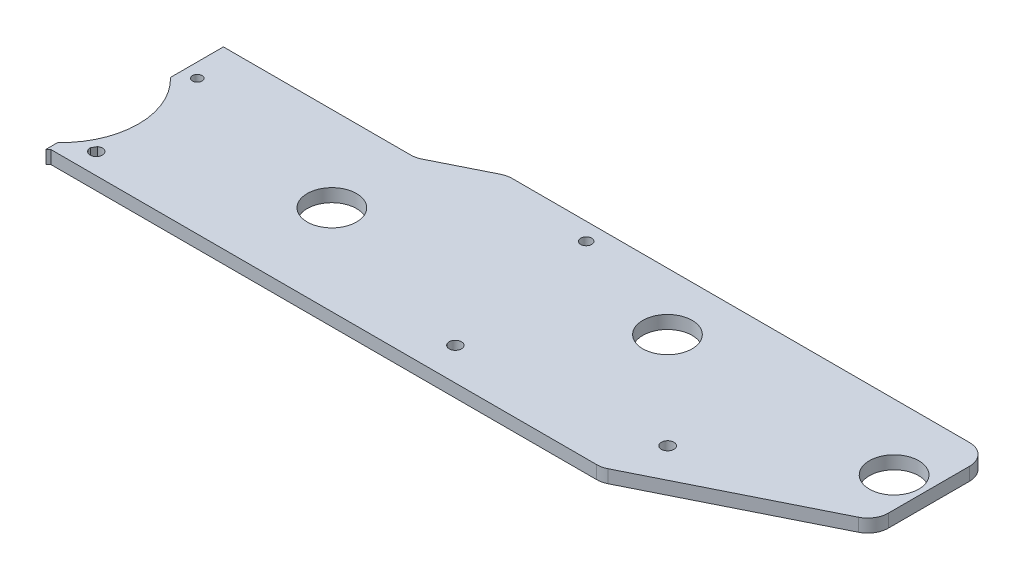
from build123d import *

# Parameters (mm, degrees)
SKETCH1_W           = 210
SKETCH1_H           = 50
SKETCH1_R           = 1.211665018
SKETCH1_R_2         = 1.165617118
SKETCH1_R_3         = 1.5
SKETCH1_R_4         = 1.517273905
SKETCH1_R_5         = 1.335614121
SKETCH1_R_6         = 1.62438417
BOSS_EXTRUDE1_DEPTH = 3.175
SKETCH2_R           = 2
CUT_EXTRUDE1_DEPTH  = 10
SKETCH3_R           = 6
SKETCH3_R_2         = 0.586995366
CUT_EXTRUDE2_DEPTH  = 57.15
CUT_EXTRUDE7_DEPTH  = 10
FILLET3_R           = 5
SKETCH11_R          = 18.5
SKETCH11_R_2        = 2
BOSS_EXTRUDE4_DEPTH = 3.175
SKETCH12_R          = 21
BOSS_EXTRUDE5_DEPTH = 3.175
SKETCH13_R          = 18.85
CUT_EXTRUDE8_DEPTH  = 3.175
BOSS_EXTRUDE6_DEPTH = 3.175
FILLET4_R           = 5
SKETCH15_R          = 1.5
CUT_EXTRUDE9_DEPTH  = 10
SKETCH16_R          = 1.5
CUT_EXTRUDE10_DEPTH = 10
SKETCH17_W          = 82.811100577
SKETCH17_H          = 66.522656387
CUT_EXTRUDE11_DEPTH = 10


with BuildPart() as part:
    # Sketch1 → Boss-Extrude1 (new body)
    with BuildSketch(Plane(origin=(0, 0, 0), x_dir=(1, 0, 0), z_dir=(0, 1, 0))):
        with Locations((105, -25)):
            Rectangle(SKETCH1_W, SKETCH1_H)
        with Locations((3.489526233, -16.787661112)):
            Circle(SKETCH1_R, mode=Mode.SUBTRACT)
        with Locations((34.37258772, -17.194005245)):
            Circle(SKETCH1_R_2, mode=Mode.SUBTRACT)
        with Locations((37.520749958, -44.921198121)):
            Circle(SKETCH1_R_3, mode=Mode.SUBTRACT)
        with Locations((168.975233936, -37.403209633)):
            Circle(SKETCH1_R_4, mode=Mode.SUBTRACT)
        with Locations((116, -4.237214774)):
            Circle(SKETCH1_R_5, mode=Mode.SUBTRACT)
        with Locations((12.257640281, -3.274812063)):
            Circle(SKETCH1_R_6, mode=Mode.SUBTRACT)
    extrude(amount=BOSS_EXTRUDE1_DEPTH)

    # Sketch2 → Cut-Extrude1 (cut)
    with BuildSketch(Plane(origin=(0, 3.175, 0), x_dir=(1, 0, 0), z_dir=(0, 1, 0))):
        with Locations((10, -26)):
            Circle(SKETCH2_R)
        with Locations((10, -42)):
            Circle(SKETCH2_R)
        with Locations((26, -26)):
            Circle(SKETCH2_R)
        with Locations((26, -42)):
            Circle(SKETCH2_R)
    extrude(amount=-CUT_EXTRUDE1_DEPTH, mode=Mode.SUBTRACT)

    # Sketch3 → Cut-Extrude2 (cut)
    with BuildSketch(Plane(origin=(0, 3.175, 0), x_dir=(1, 0, 0), z_dir=(0, 1, 0))):
        with Locations((78.01026379, -28.1)):
            Circle(SKETCH3_R)
        with Locations((145.531297368, -14)):
            Circle(SKETCH3_R)
        with Locations((18, -34)):
            Circle(SKETCH3_R_2)
        with Locations((202.646291021, -16)):
            Circle(SKETCH3_R)
    extrude(amount=-CUT_EXTRUDE2_DEPTH, mode=Mode.SUBTRACT)

    # Sketch10 → Cut-Extrude7 (cut)
    with BuildSketch(Plane(origin=(0, 3.175, 0), x_dir=(1, 0, 0), z_dir=(0, 1, 0))):
        Polygon((210, -27.859435908), (165.502877994, -50), (210, -50), align=None)
        Polygon((92.532613397, 0), (77.65477062, -7.402812063), (0, -7.402812063), (0, 0), align=None)
    extrude(amount=-CUT_EXTRUDE7_DEPTH, mode=Mode.SUBTRACT)

    # Fillet3
    fillet3_edges = [part.edges().sort_by_distance(p)[0] for p in [
        (0, 1.5875, 50),
        (0, 1.5875, 7.402812063),
        (77.65477062, 1.5875, 7.402812063),
        (92.532613397, 1.5875, 0),
        (210, 1.5875, 0),
        (210, 1.5875, 27.859435908),
        (165.502877994, 1.5875, 50),
    ]]
    fillet(fillet3_edges, radius=FILLET3_R)

    # Sketch11 → Boss-Extrude4 (add)
    with BuildSketch(Plane(origin=(0, 3.175, 0), x_dir=(1, 0, 0), z_dir=(0, 1, 0))):
        with Locations((18, -34)):
            Circle(SKETCH11_R)
        with Locations((10, -26)):
            Circle(SKETCH11_R_2, mode=Mode.SUBTRACT)
        with Locations((10, -42)):
            Circle(SKETCH11_R_2, mode=Mode.SUBTRACT)
        with Locations((26, -26)):
            Circle(SKETCH11_R_2, mode=Mode.SUBTRACT)
        with Locations((26, -42)):
            Circle(SKETCH11_R_2, mode=Mode.SUBTRACT)
    extrude(amount=-BOSS_EXTRUDE4_DEPTH)

    # Sketch12 → Boss-Extrude5 (add)
    with BuildSketch(Plane(origin=(0, 3.175, 0), x_dir=(1, 0, 0), z_dir=(0, 1, 0))):
        with Locations((18, -34)):
            Circle(SKETCH12_R)
    extrude(amount=-BOSS_EXTRUDE5_DEPTH)

    # Sketch13 → Cut-Extrude8 (cut)
    with BuildSketch(Plane(origin=(0, 3.175, 0), x_dir=(1, 0, 0), z_dir=(0, 1, 0))):
        with Locations((18, -34)):
            Circle(SKETCH13_R)
    extrude(amount=-CUT_EXTRUDE8_DEPTH, mode=Mode.SUBTRACT)

    # Sketch14 → Boss-Extrude6 (add)
    with BuildSketch(Plane(origin=(0, 3.175, 0), x_dir=(1, 0, 0), z_dir=(0, 1, 0))):
        with BuildLine():
            Line((-35.83, -34.272812063), (-2.998227868, -34.272812063))
            ThreePointArc((-2.998227868, -34.272812063), (-2.272136238, -28.519079241), (0, -23.183346174))
            Line((0, -23.183346174), (0, -12.248529085))
            Line((0, -12.248529085), (0.002380891, -12.248529085))
            ThreePointArc((0.002380891, -12.248529085), (1.51944077, -8.813145304), (5, -7.402812063))
            Line((5, -7.402812063), (18, -7.402812063))
            Line((18, -7.402812063), (18, 0.727187937))
            Line((18, 0.727187937), (-35.83, 0.727187937))
            Line((-35.83, 0.727187937), (-35.83, -34.272812063))
        make_face()
    extrude(amount=-BOSS_EXTRUDE6_DEPTH)

    # Fillet4
    fillet4_edges = [part.edges().sort_by_distance(p)[0] for p in [
        (18, 1.5875, -0.727187937),
        (-35.83, 1.5875, 34.272812063),
        (-35.83, 1.5875, -0.727187937),
    ]]
    fillet(fillet4_edges, radius=FILLET4_R)

    # Sketch15 → Cut-Extrude9 (cut)
    with BuildSketch(Plane(origin=(0, 3.175, 0), x_dir=(1, 0, 0), z_dir=(0, 1, 0))):
        with Locations((122, -42.058139805)):
            Circle(SKETCH15_R)
    extrude(amount=-CUT_EXTRUDE9_DEPTH, mode=Mode.SUBTRACT)

    # Sketch16 → Cut-Extrude10 (cut)
    with BuildSketch(Plane(origin=(0, 3.175, 0), x_dir=(1, 0, 0), z_dir=(0, 1, 0))):
        with Locations((12, -3.272812063)):
            Circle(SKETCH16_R)
    extrude(amount=-CUT_EXTRUDE10_DEPTH, mode=Mode.SUBTRACT)

    # Sketch17 → Cut-Extrude11 (cut)
    with BuildSketch(Plane(origin=(0, 3.175, 0), x_dir=(1, 0, 0), z_dir=(0, 1, 0))):
        with Locations((-10.47799366, -23.384449303)):
            Rectangle(SKETCH17_W, SKETCH17_H)
    extrude(amount=-CUT_EXTRUDE11_DEPTH, mode=Mode.SUBTRACT)


solid = part.part
